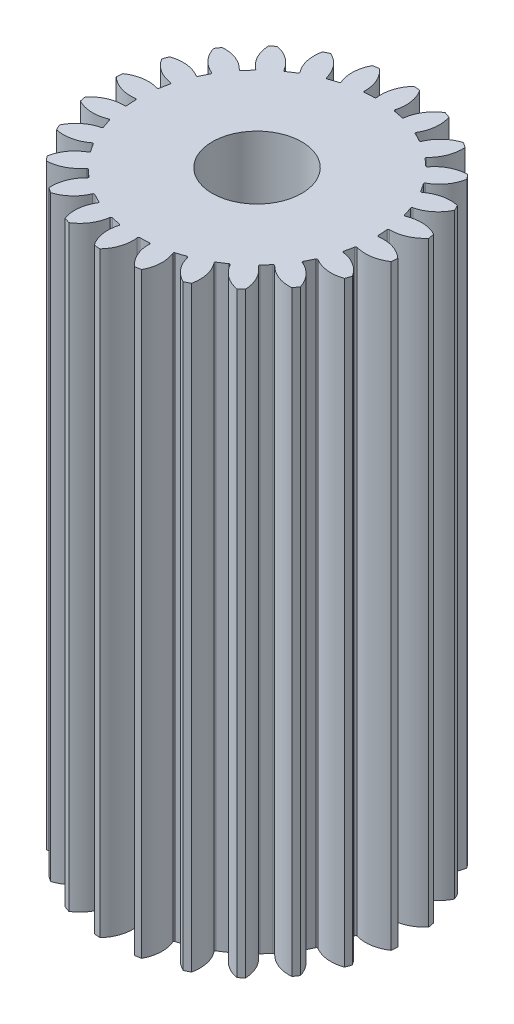
from build123d import *

# Parameters (mm, degrees)
CROQUIS1_R              = 2.5
SALIENTE_EXTRUIR2_DEPTH = 10
CORTAR_EXTRUIR1_DEPTH   = 10
MATRIZC2_START          = -10
MATRIZC2_DEPTH          = 10
CROQUIS3_R              = 0.75
CORTAR_EXTRUIR2_DEPTH   = 10


# Read off the part's stored shape, not the designer's step: MatrizC2
with BuildPart() as part:
    # Croquis1 → Saliente-Extruir2 (new body)
    with BuildSketch(Plane(origin=(0, 0, 0), x_dir=(1, 0, 0), z_dir=(0, 1, 0))):
        with Locations(Location((0, 0, 0), (0, 0, 270))):
            Circle(CROQUIS1_R)
    extrude(amount=-SALIENTE_EXTRUIR2_DEPTH)

    # Croquis2 → Cortar-Extruir1 (cut)
    with BuildSketch(Plane(origin=(0, 0, 0), x_dir=(1, 0, 0), z_dir=(0, 1, 0))):
        with BuildLine():
            ThreePointArc((-0.014738808, 2.022346436), (0.007703993, 2.276266115), (0.136450418, 2.496273479))
            ThreePointArc((0.136450418, 2.496273479), (-0.138888889, 2.496138994), (-0.412543491, 2.465726641))
            ThreePointArc((-0.412543491, 2.465726641), (-0.260184287, 2.261360412), (-0.209710296, 2.011497932))
            ThreePointArc((-0.209710296, 2.011497932), (-0.203333466, 1.996424475), (-0.18783648, 1.991159827))
            ThreePointArc((-0.18783648, 1.991159827), (-0.111111111, 1.996911195), (-0.034221302, 1.999707204))
            ThreePointArc((-0.034221302, 1.999707204), (-0.019404034, 2.006658582), (-0.014738808, 2.022346436))
        make_face()
    extrude(amount=-CORTAR_EXTRUIR1_DEPTH, mode=Mode.SUBTRACT)

    # MatrizC2 outline → MatrizC2 (cut)
    with BuildSketch(Plane(origin=(0, 0, 0), x_dir=(1, 0, 0), z_dir=(0, 1, 0)).offset(MATRIZC2_START)):
        with BuildLine():
            ThreePointArc((0.509185178, 1.957251337), (0.596582508, 2.196710287), (0.777884101, 2.375899056))
            ThreePointArc((0.777884101, 2.375899056), (0.511891946, 2.447032209), (0.239690603, 2.488483155))
            ThreePointArc((0.239690603, 2.488483155), (0.33396442, 2.251647073), (0.318049383, 1.997234821))
            ThreePointArc((0.318049383, 1.997234821), (0.320307631, 1.981024534), (0.333913978, 1.97192836))
            ThreePointArc((0.333913978, 1.97192836), (0.409513557, 1.957625768), (0.48450707, 1.940425958))
            ThreePointArc((0.48450707, 1.940425958), (0.500618601, 1.943305483), (0.509185178, 1.957251337))
        make_face()
        with BuildLine():
            ThreePointArc((0.998409035, 1.758772793), (1.144804911, 1.967452284), (1.366306268, 2.093611039))
            ThreePointArc((1.366306268, 2.093611039), (1.12778819, 2.231164224), (0.875590178, 2.341653654))
            ThreePointArc((0.875590178, 2.341653654), (0.905354004, 2.088487707), (0.824134522, 1.846863457))
            ThreePointArc((0.824134522, 1.846863457), (0.822120291, 1.830621045), (0.83290875, 1.818313233))
            ThreePointArc((0.83290875, 1.818313233), (0.902230553, 1.78493138), (0.970217085, 1.74890789))
            ThreePointArc((0.970217085, 1.74890789), (0.986524904, 1.747519326), (0.998409035, 1.758772793))
        make_face()
        with BuildLine():
            ThreePointArc((1.419592967, 1.44043679), (1.615010751, 1.604115659), (1.861616921, 1.668646889))
            ThreePointArc((1.861616921, 1.668646889), (1.666827533, 1.863246084), (1.451819728, 2.035244327))
            ThreePointArc((1.451819728, 2.035244327), (1.415045208, 1.783001356), (1.274056256, 1.570631401))
            ThreePointArc((1.274056256, 1.570631401), (1.267906812, 1.555463757), (1.275142168, 1.540783065))
            ThreePointArc((1.275142168, 1.540783065), (1.333462028, 1.490596868), (1.38980841, 1.438204639))
            ThreePointArc((1.38980841, 1.438204639), (1.405201167, 1.432642615), (1.419592967, 1.44043679))
        make_face()
        with BuildLine():
            ThreePointArc((1.744033985, 1.023937401), (1.975156278, 1.131461203), (2.230061457, 1.129967211))
            ThreePointArc((2.230061457, 1.129967211), (2.092275335, 1.368350802), (1.929110164, 1.590136462))
            ThreePointArc((1.929110164, 1.590136462), (1.82830342, 1.356006408), (1.637153161, 1.18736341))
            ThreePointArc((1.637153161, 1.18736341), (1.627287579, 1.174304184), (1.630476753, 1.158251077))
            ThreePointArc((1.630476753, 1.158251077), (1.673820268, 1.094680642), (1.714686588, 1.029490119))
            ThreePointArc((1.714686588, 1.029490119), (1.728115292, 1.020133677), (1.744033985, 1.023937401))
        make_face()
        with BuildLine():
            ThreePointArc((1.949621968, 0.537658369), (2.200698168, 0.581699536), (2.44653099, 0.514282135))
            ThreePointArc((2.44653099, 0.514282135), (2.375138029, 0.780204675), (2.27493493, 1.036663426))
            ThreePointArc((2.27493493, 1.036663426), (2.116965776, 0.836601865), (1.888680784, 0.723178565))
            ThreePointArc((1.888680784, 0.723178565), (1.875771387, 0.713117722), (1.874697043, 0.696786192))
            ThreePointArc((1.874697043, 0.696786192), (1.900110424, 0.624163741), (1.922711709, 0.550617549))
            ThreePointArc((1.922711709, 0.550617549), (1.933261215, 0.538104316), (1.949621968, 0.537658369))
        make_face()
        with BuildLine():
            ThreePointArc((2.022346436, 0.014738808), (2.276266114, -0.007703993), (2.496273479, -0.136450418))
            ThreePointArc((2.496273479, -0.136450418), (2.496138992, 0.138888889), (2.46572664, 0.412543491))
            ThreePointArc((2.46572664, 0.412543491), (2.261360412, 0.260184287), (2.011497932, 0.209710296))
            ThreePointArc((2.011497932, 0.209710296), (1.996424475, 0.203333466), (1.991159827, 0.18783648))
            ThreePointArc((1.991159827, 0.18783648), (1.996911195, 0.111111111), (1.999707204, 0.034221302))
            ThreePointArc((1.999707204, 0.034221302), (2.006658582, 0.019404034), (2.022346436, 0.014738808))
        make_face()
        with BuildLine():
            ThreePointArc((1.957251337, -0.509185178), (2.196710287, -0.596582508), (2.375899056, -0.777884101))
            ThreePointArc((2.375899056, -0.777884101), (2.447032208, -0.511891946), (2.488483154, -0.239690603))
            ThreePointArc((2.488483154, -0.239690603), (2.251647073, -0.33396442), (1.997234821, -0.318049383))
            ThreePointArc((1.997234821, -0.318049383), (1.981024534, -0.320307631), (1.97192836, -0.333913978))
            ThreePointArc((1.97192836, -0.333913978), (1.957625768, -0.409513557), (1.940425958, -0.48450707))
            ThreePointArc((1.940425958, -0.48450707), (1.943305483, -0.500618601), (1.957251337, -0.509185178))
        make_face()
        with BuildLine():
            ThreePointArc((1.758772793, -0.998409035), (1.967452284, -1.144804911), (2.093611039, -1.366306268))
            ThreePointArc((2.093611039, -1.366306268), (2.231164223, -1.12778819), (2.341653654, -0.875590178))
            ThreePointArc((2.341653654, -0.875590178), (2.088487707, -0.905354004), (1.846863457, -0.824134522))
            ThreePointArc((1.846863457, -0.824134522), (1.830621045, -0.822120291), (1.818313233, -0.83290875))
            ThreePointArc((1.818313233, -0.83290875), (1.78493138, -0.902230553), (1.74890789, -0.970217085))
            ThreePointArc((1.74890789, -0.970217085), (1.747519326, -0.986524904), (1.758772793, -0.998409035))
        make_face()
        with BuildLine():
            ThreePointArc((1.44043679, -1.419592967), (1.604115659, -1.615010751), (1.668646889, -1.861616921))
            ThreePointArc((1.668646889, -1.861616921), (1.863246084, -1.666827534), (2.035244327, -1.451819728))
            ThreePointArc((2.035244327, -1.451819728), (1.783001356, -1.415045208), (1.570631401, -1.274056256))
            ThreePointArc((1.570631401, -1.274056256), (1.555463757, -1.267906812), (1.540783065, -1.275142168))
            ThreePointArc((1.540783065, -1.275142168), (1.490596868, -1.333462028), (1.438204639, -1.38980841))
            ThreePointArc((1.438204639, -1.38980841), (1.432642615, -1.405201167), (1.44043679, -1.419592967))
        make_face()
        with BuildLine():
            ThreePointArc((1.023937401, -1.744033985), (1.131461203, -1.975156278), (1.129967211, -2.230061457))
            ThreePointArc((1.129967211, -2.230061457), (1.368350802, -2.092275335), (1.590136463, -1.929110165))
            ThreePointArc((1.590136463, -1.929110165), (1.356006408, -1.82830342), (1.18736341, -1.637153161))
            ThreePointArc((1.18736341, -1.637153161), (1.174304184, -1.627287579), (1.158251077, -1.630476753))
            ThreePointArc((1.158251077, -1.630476753), (1.094680642, -1.673820268), (1.029490119, -1.714686588))
            ThreePointArc((1.029490119, -1.714686588), (1.020133677, -1.728115292), (1.023937401, -1.744033985))
        make_face()
        with BuildLine():
            ThreePointArc((0.537658369, -1.949621968), (0.581699536, -2.200698168), (0.514282135, -2.44653099))
            ThreePointArc((0.514282135, -2.44653099), (0.780204676, -2.37513803), (1.036663427, -2.27493493))
            ThreePointArc((1.036663427, -2.27493493), (0.836601865, -2.116965776), (0.723178565, -1.888680784))
            ThreePointArc((0.723178565, -1.888680784), (0.713117722, -1.875771387), (0.696786192, -1.874697043))
            ThreePointArc((0.696786192, -1.874697043), (0.624163741, -1.900110424), (0.550617549, -1.922711709))
            ThreePointArc((0.550617549, -1.922711709), (0.538104316, -1.933261215), (0.537658369, -1.949621968))
        make_face()
        with BuildLine():
            ThreePointArc((0.014738808, -2.022346436), (-0.007703993, -2.276266114), (-0.136450418, -2.496273479))
            ThreePointArc((-0.136450418, -2.496273479), (0.138888889, -2.496138994), (0.412543491, -2.465726641))
            ThreePointArc((0.412543491, -2.465726641), (0.260184287, -2.261360412), (0.209710296, -2.011497932))
            ThreePointArc((0.209710296, -2.011497932), (0.203333466, -1.996424475), (0.18783648, -1.991159827))
            ThreePointArc((0.18783648, -1.991159827), (0.111111111, -1.996911195), (0.034221302, -1.999707204))
            ThreePointArc((0.034221302, -1.999707204), (0.019404034, -2.006658582), (0.014738808, -2.022346436))
        make_face()
        with BuildLine():
            ThreePointArc((-0.509185178, -1.957251337), (-0.596582508, -2.196710287), (-0.777884101, -2.375899056))
            ThreePointArc((-0.777884101, -2.375899056), (-0.511891946, -2.44703221), (-0.239690603, -2.488483156))
            ThreePointArc((-0.239690603, -2.488483156), (-0.33396442, -2.251647073), (-0.318049383, -1.997234821))
            ThreePointArc((-0.318049383, -1.997234821), (-0.320307631, -1.981024534), (-0.333913978, -1.97192836))
            ThreePointArc((-0.333913978, -1.97192836), (-0.409513557, -1.957625768), (-0.48450707, -1.940425958))
            ThreePointArc((-0.48450707, -1.940425958), (-0.500618601, -1.943305483), (-0.509185178, -1.957251337))
        make_face()
        with BuildLine():
            ThreePointArc((-0.998409035, -1.758772793), (-1.144804911, -1.967452284), (-1.366306268, -2.093611039))
            ThreePointArc((-1.366306268, -2.093611039), (-1.127788191, -2.231164225), (-0.875590178, -2.341653656))
            ThreePointArc((-0.875590178, -2.341653656), (-0.905354004, -2.088487707), (-0.824134522, -1.846863457))
            ThreePointArc((-0.824134522, -1.846863457), (-0.822120291, -1.830621045), (-0.83290875, -1.818313233))
            ThreePointArc((-0.83290875, -1.818313233), (-0.902230553, -1.78493138), (-0.970217085, -1.74890789))
            ThreePointArc((-0.970217085, -1.74890789), (-0.986524904, -1.747519326), (-0.998409035, -1.758772793))
        make_face()
        with BuildLine():
            ThreePointArc((-1.419592967, -1.44043679), (-1.615010751, -1.604115659), (-1.861616921, -1.668646889))
            ThreePointArc((-1.861616921, -1.668646889), (-1.666827535, -1.863246085), (-1.45181973, -2.035244329))
            ThreePointArc((-1.45181973, -2.035244329), (-1.415045208, -1.783001356), (-1.274056256, -1.570631401))
            ThreePointArc((-1.274056256, -1.570631401), (-1.267906812, -1.555463757), (-1.275142168, -1.540783065))
            ThreePointArc((-1.275142168, -1.540783065), (-1.333462028, -1.490596868), (-1.38980841, -1.438204639))
            ThreePointArc((-1.38980841, -1.438204639), (-1.405201167, -1.432642615), (-1.419592967, -1.44043679))
        make_face()
        with BuildLine():
            ThreePointArc((-1.744033985, -1.023937401), (-1.975156278, -1.131461203), (-2.230061457, -1.129967211))
            ThreePointArc((-2.230061457, -1.129967211), (-2.092275337, -1.368350803), (-1.929110166, -1.590136464))
            ThreePointArc((-1.929110166, -1.590136464), (-1.82830342, -1.356006408), (-1.637153161, -1.18736341))
            ThreePointArc((-1.637153161, -1.18736341), (-1.627287579, -1.174304184), (-1.630476753, -1.158251077))
            ThreePointArc((-1.630476753, -1.158251077), (-1.673820268, -1.094680642), (-1.714686588, -1.029490119))
            ThreePointArc((-1.714686588, -1.029490119), (-1.728115292, -1.020133677), (-1.744033985, -1.023937401))
        make_face()
        with BuildLine():
            ThreePointArc((-1.949621968, -0.537658369), (-2.200698168, -0.581699536), (-2.44653099, -0.514282135))
            ThreePointArc((-2.44653099, -0.514282135), (-2.375138032, -0.780204676), (-2.274934932, -1.036663427))
            ThreePointArc((-2.274934932, -1.036663427), (-2.116965776, -0.836601865), (-1.888680784, -0.723178565))
            ThreePointArc((-1.888680784, -0.723178565), (-1.875771387, -0.713117722), (-1.874697043, -0.696786192))
            ThreePointArc((-1.874697043, -0.696786192), (-1.900110424, -0.624163741), (-1.922711709, -0.550617549))
            ThreePointArc((-1.922711709, -0.550617549), (-1.933261215, -0.538104316), (-1.949621968, -0.537658369))
        make_face()
        with BuildLine():
            ThreePointArc((-2.022346436, -0.014738808), (-2.276266114, 0.007703993), (-2.496273479, 0.136450418))
            ThreePointArc((-2.496273479, 0.136450418), (-2.496138995, -0.138888889), (-2.465726642, -0.412543491))
            ThreePointArc((-2.465726642, -0.412543491), (-2.261360412, -0.260184287), (-2.011497932, -0.209710296))
            ThreePointArc((-2.011497932, -0.209710296), (-1.996424475, -0.203333466), (-1.991159827, -0.18783648))
            ThreePointArc((-1.991159827, -0.18783648), (-1.996911195, -0.111111111), (-1.999707204, -0.034221302))
            ThreePointArc((-1.999707204, -0.034221302), (-2.006658582, -0.019404034), (-2.022346436, -0.014738808))
        make_face()
        with BuildLine():
            ThreePointArc((-1.957251337, 0.509185178), (-2.196710287, 0.596582508), (-2.375899056, 0.777884101))
            ThreePointArc((-2.375899056, 0.777884101), (-2.447032211, 0.511891946), (-2.488483157, 0.239690603))
            ThreePointArc((-2.488483157, 0.239690603), (-2.251647073, 0.33396442), (-1.997234821, 0.318049383))
            ThreePointArc((-1.997234821, 0.318049383), (-1.981024534, 0.320307631), (-1.97192836, 0.333913978))
            ThreePointArc((-1.97192836, 0.333913978), (-1.957625768, 0.409513557), (-1.940425958, 0.48450707))
            ThreePointArc((-1.940425958, 0.48450707), (-1.943305483, 0.500618601), (-1.957251337, 0.509185178))
        make_face()
        with BuildLine():
            ThreePointArc((-1.758772793, 0.998409035), (-1.967452284, 1.144804911), (-2.093611039, 1.366306268))
            ThreePointArc((-2.093611039, 1.366306268), (-2.231164226, 1.127788191), (-2.341653656, 0.875590178))
            ThreePointArc((-2.341653656, 0.875590178), (-2.088487707, 0.905354004), (-1.846863457, 0.824134522))
            ThreePointArc((-1.846863457, 0.824134522), (-1.830621045, 0.822120291), (-1.818313233, 0.83290875))
            ThreePointArc((-1.818313233, 0.83290875), (-1.78493138, 0.902230553), (-1.74890789, 0.970217085))
            ThreePointArc((-1.74890789, 0.970217085), (-1.747519326, 0.986524904), (-1.758772793, 0.998409035))
        make_face()
        with BuildLine():
            ThreePointArc((-1.44043679, 1.419592967), (-1.604115659, 1.615010751), (-1.668646889, 1.861616921))
            ThreePointArc((-1.668646889, 1.861616921), (-1.863246085, 1.666827535), (-2.035244329, 1.45181973))
            ThreePointArc((-2.035244329, 1.45181973), (-1.783001356, 1.415045208), (-1.570631401, 1.274056256))
            ThreePointArc((-1.570631401, 1.274056256), (-1.555463757, 1.267906812), (-1.540783065, 1.275142168))
            ThreePointArc((-1.540783065, 1.275142168), (-1.490596868, 1.333462028), (-1.438204639, 1.38980841))
            ThreePointArc((-1.438204639, 1.38980841), (-1.432642615, 1.405201167), (-1.44043679, 1.419592967))
        make_face()
        with BuildLine():
            ThreePointArc((-1.023937401, 1.744033985), (-1.131461203, 1.975156278), (-1.129967211, 2.230061457))
            ThreePointArc((-1.129967211, 2.230061457), (-1.368350803, 2.092275336), (-1.590136464, 1.929110166))
            ThreePointArc((-1.590136464, 1.929110166), (-1.356006408, 1.82830342), (-1.18736341, 1.637153161))
            ThreePointArc((-1.18736341, 1.637153161), (-1.174304184, 1.627287579), (-1.158251077, 1.630476753))
            ThreePointArc((-1.158251077, 1.630476753), (-1.094680642, 1.673820268), (-1.029490119, 1.714686588))
            ThreePointArc((-1.029490119, 1.714686588), (-1.020133677, 1.728115292), (-1.023937401, 1.744033985))
        make_face()
        with BuildLine():
            ThreePointArc((-0.696786192, 1.874697043), (-0.624163741, 1.900110424), (-0.550617549, 1.922711709))
            ThreePointArc((-0.550617549, 1.922711709), (-0.538104316, 1.933261215), (-0.537658369, 1.949621968))
            ThreePointArc((-0.537658369, 1.949621968), (-0.581699536, 2.200698168), (-0.514282135, 2.44653099))
            ThreePointArc((-0.514282135, 2.44653099), (-0.780204676, 2.375138031), (-1.036663427, 2.274934931))
            ThreePointArc((-1.036663427, 2.274934931), (-0.836601865, 2.116965776), (-0.723178565, 1.888680784))
            ThreePointArc((-0.723178565, 1.888680784), (-0.713117722, 1.875771387), (-0.696786192, 1.874697043))
        make_face()
    extrude(amount=MATRIZC2_DEPTH, mode=Mode.SUBTRACT)

    # Croquis3 → Cortar-Extruir2 (cut)
    with BuildSketch(Plane(origin=(0, 0, 0), x_dir=(1, 0, 0), z_dir=(0, 1, 0))):
        with Locations(Location((0, 0, 0), (0, 0, 270))):
            Circle(CROQUIS3_R)
    extrude(amount=-CORTAR_EXTRUIR2_DEPTH, mode=Mode.SUBTRACT)


solid = part.part
